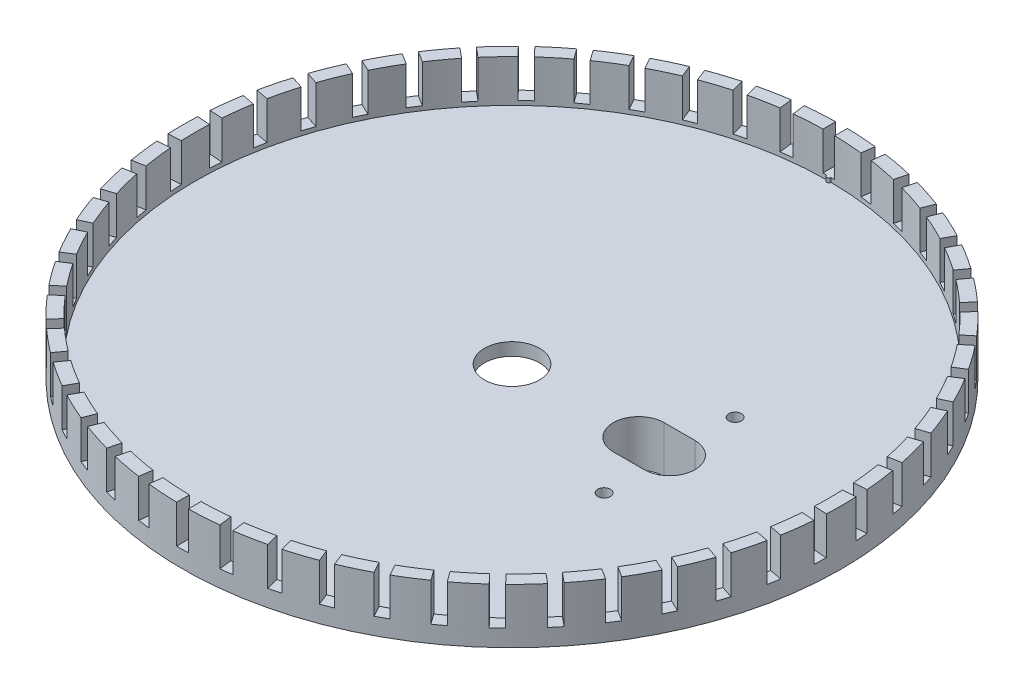
from build123d import *
from build123d.topology import SkipClean

# Parameters (mm, degrees)
SKETCH_2_W               = 2.765305558
SKETCH_2_H               = 18
CUT_EXTRUDE_1_DEPTH      = 112.072048689
PATTERN_CIRCULAR_1_COUNT = 50
EXTRUDE_START            = -10
SKETCH_3_R               = 0.5
EXTRUDE_1_DEPTH          = 1
CUT_EXTRUDE_2_DEPTH      = 111.761003968
CUT_EXTRUDE_2_DEPTH_BACK = 111.761003968
SKETCH_4_R               = 6.5
CUT_EXTRUDE_3_DEPTH      = 111.761003968
CUT_EXTRUDE_3_DEPTH_BACK = 111.761003968
SKETCH_5_R               = 1.5
SKETCH_6_R               = 20
EXTRUDE_2_DEPTH          = 8
CUT_EXTRUDE_4_DEPTH      = 112.072048689
CUT_EXTRUDE_4_DEPTH_BACK = 112.072048689
SKETCH_7_R               = 1.5


with BuildPart() as part:
    # 草图1 → 旋转1 (revolve)
    with BuildSketch(Plane.XY):
        Polygon((0, 0), (-78, 0), (-78, 13), (-75, 13), (-75, 3), (0, 3), align=None)
    revolve(axis=Axis((0, -268.437842181, 0), (0, 1, 0)))

    # 草图2 → 切除-拉伸1 (cut, symmetric)
    with BuildSketch(Plane.XY):
        with Locations((0, 13)):
            Rectangle(SKETCH_2_W, SKETCH_2_H)
    cut_extrude_1 = extrude(amount=CUT_EXTRUDE_1_DEPTH, both=True, mode=Mode.SUBTRACT)

    # 阵列(圆周)1: 切除-拉伸1 ×50 about axis
    pattern_circular_1_axis = Axis((0, 13, 0), (0, -1, 0))
    for i in range(1, PATTERN_CIRCULAR_1_COUNT):
        add(cut_extrude_1.rotate(pattern_circular_1_axis, i * 360 / PATTERN_CIRCULAR_1_COUNT), mode=Mode.SUBTRACT)

    # 草图3 → 凸台-拉伸1 (add)
    with BuildSketch(Plane(origin=(0, 13, 0), x_dir=(1, 0, 0), z_dir=(0, 1, 0)).offset(EXTRUDE_START)):
        with Locations((0, 75)):
            Circle(SKETCH_3_R)
    extrude(amount=EXTRUDE_1_DEPTH)

    # 草图4 → 切除-拉伸2 (cut, two sides: drawn at the far end of the back side and taken through both)
    with BuildSketch(Plane(origin=(0, 3, 0), x_dir=(1, 0, 0), z_dir=(0, 1, 0)).offset(-CUT_EXTRUDE_2_DEPTH_BACK)):
        Circle(SKETCH_4_R)
    extrude(amount=CUT_EXTRUDE_2_DEPTH + CUT_EXTRUDE_2_DEPTH_BACK, mode=Mode.SUBTRACT)

    # 草图5 → 切除-拉伸3 (cut, two sides: drawn at the far end of the back side and taken through both)
    with BuildSketch(Plane(origin=(0, 3, 0), x_dir=(1, 0, 0), z_dir=(0, 1, 0)).offset(-CUT_EXTRUDE_3_DEPTH_BACK)):
        with Locations((37.3, 15.5)):
            Circle(SKETCH_5_R)
        with Locations((37.3, -15.5)):
            Circle(SKETCH_5_R)
        with BuildLine():
            Line((30, 6), (37.3, 6))
            ThreePointArc((37.3, 6), (43.3, 0), (37.3, -6))
            Line((37.3, -6), (30, -6))
            ThreePointArc((30, -6), (24, 0), (30, 6))
        make_face()
    extrude(amount=CUT_EXTRUDE_3_DEPTH + CUT_EXTRUDE_3_DEPTH_BACK, mode=Mode.SUBTRACT)

    # 草图6 → 凸台-拉伸2 (add)
    with BuildSketch(Plane.XZ):
        with Locations((37.3, 0)):
            Circle(SKETCH_6_R)
    extrude(amount=EXTRUDE_2_DEPTH)

    # 草图7 → 切除-拉伸4 (cut, two sides: drawn at the far end of the back side and taken through both)
    with SkipClean():  # the faces are left unmerged after this step: merging them gives an invalid solid
        with BuildSketch(Plane(origin=(0, 0, 0), x_dir=(1, 0, 0), z_dir=(0, 1, 0)).offset(-CUT_EXTRUDE_4_DEPTH_BACK)):
            with Locations((37.3, -15.5)):
                Circle(SKETCH_7_R)
            with Locations((37.3, 15.5)):
                Circle(SKETCH_7_R)
            with BuildLine():
                Line((37.3, 6), (30, 6))
                ThreePointArc((30, 6), (24, 0), (30, -6))
                Line((30, -6), (37.3, -6))
                ThreePointArc((37.3, -6), (43.3, 0), (37.3, 6))
            make_face()
        extrude(amount=CUT_EXTRUDE_4_DEPTH + CUT_EXTRUDE_4_DEPTH_BACK, mode=Mode.SUBTRACT)
    add(part.part.scale(1), mode=Mode.REPLACE)  # the faces are merged on a copy


solid = part.part
